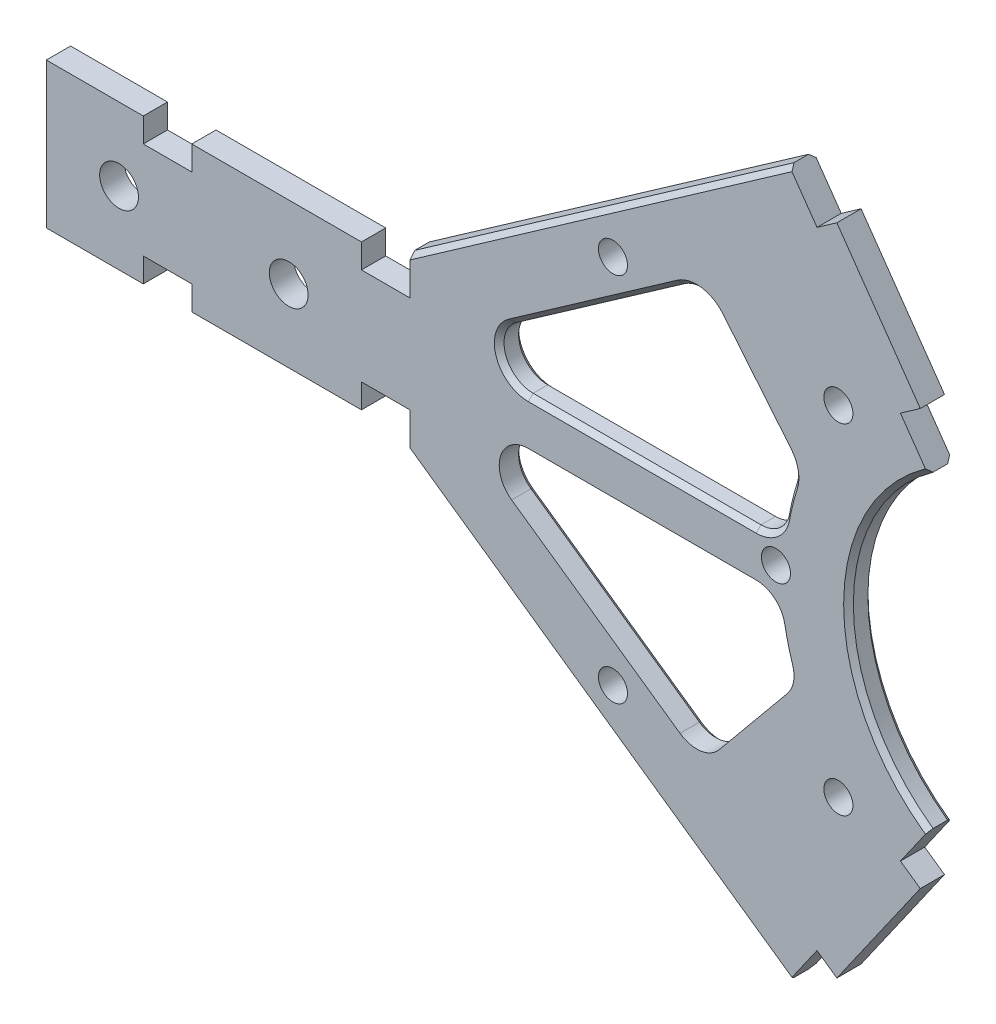
from build123d import *

# Parameters (mm, degrees)
SKETCH1_R           = 4
SKETCH1_R_2         = 3
BOSS_EXTRUDE1_DEPTH = 5
CHAMFER1_SIZE       = 1


with BuildPart() as part:
    # Sketch1 → Boss-Extrude1 (new body)
    with BuildSketch(Plane.XY):
        with BuildLine():
            Line((-184.5, 15), (-204.5, 15))
            Line((-204.5, 15), (-204.5, -15))
            Line((-204.5, -15), (-184.5, -15))
            Line((-184.5, -15), (-184.5, -10))
            Line((-184.5, -10), (-174.5, -10))
            Line((-174.5, -10), (-174.5, -15))
            Line((-174.5, -15), (-139.5, -15))
            Line((-139.5, -15), (-139.5, -10))
            Line((-139.5, -10), (-129.5, -10))
            Line((-129.5, -10), (-129.5, -18))
            Line((-129.5, -18), (-51.27097977, -72.776549672))
            Line((-51.27097977, -72.776549672), (-45.535215407, -64.585029229))
            Line((-45.535215407, -64.585029229), (-41.439455185, -67.45291141))
            Line((-41.439455185, -67.45291141), (-24.232162095, -42.878350082))
            Line((-24.232162095, -42.878350082), (-28.327922316, -40.0104679))
            Line((-28.327922316, -40.0104679), (-22.592157953, -31.818947457))
            ThreePointArc((-22.592157953, -31.818947457), (-39.041003155, 0), (-22.592157953, 31.818947457))
            Line((-22.592157953, 31.818947457), (-28.327922316, 40.0104679))
            Line((-28.327922316, 40.0104679), (-24.232162095, 42.878350082))
            Line((-24.232162095, 42.878350082), (-41.439455185, 67.45291141))
            Line((-41.439455185, 67.45291141), (-45.535215407, 64.585029229))
            Line((-45.535215407, 64.585029229), (-51.27097977, 72.776549672))
            Line((-51.27097977, 72.776549672), (-129.5, 18))
            Line((-129.5, 18), (-129.5, 10))
            Line((-129.5, 10), (-139.5, 10))
            Line((-139.5, 10), (-139.5, 15))
            Line((-139.5, 15), (-174.5, 15))
            Line((-174.5, 15), (-174.5, 10))
            Line((-174.5, 10), (-184.5, 10))
            Line((-184.5, 10), (-184.5, 15))
        make_face()
        with Locations((-189.5, 0)):
            Circle(SKETCH1_R, mode=Mode.SUBTRACT)
        with Locations((-154.5, 0)):
            Circle(SKETCH1_R, mode=Mode.SUBTRACT)
        with Locations((-87.62177039, -38.25)):
            Circle(SKETCH1_R_2, mode=Mode.SUBTRACT)
        with BuildLine():
            ThreePointArc((-108.526566115, -15.594912266), (-110.807409201, -8.875765203), (-105.085107497, -4.68))
            Line((-105.085107497, -4.68), (-58.085107497, -4.68))
            ThreePointArc((-58.085107497, -4.68), (-54.245193558, -6.069678868), (-52.184028704, -9.594979687))
            ThreePointArc((-52.184028704, -9.594979687), (-51.473369837, -12.873565341), (-50.556941566, -16.100687765))
            ThreePointArc((-50.556941566, -16.100687765), (-50.382621181, -19.057762854), (-51.644278452, -21.737856436))
            Line((-51.644278452, -21.737856436), (-65.722800473, -38.816469322))
            ThreePointArc((-65.722800473, -38.816469322), (-69.543442391, -40.945195384), (-73.794006591, -39.914912266))
            Line((-73.794006591, -39.914912266), (-108.526566115, -15.594912266))
        make_face(mode=Mode.SUBTRACT)
        with Locations((-41.12177039, -35)):
            Circle(SKETCH1_R_2, mode=Mode.SUBTRACT)
        with BuildLine():
            Line((-58.085107497, 4.68), (-105.085107497, 4.68))
            ThreePointArc((-105.085107497, 4.68), (-110.807409201, 8.875765203), (-108.526566115, 15.594912266))
            Line((-108.526566115, 15.594912266), (-73.794006591, 39.914912266))
            ThreePointArc((-73.794006591, 39.914912266), (-69.543442391, 40.945195384), (-65.722800473, 38.816469322))
            Line((-65.722800473, 38.816469322), (-51.644278452, 21.737856436))
            ThreePointArc((-51.644278452, 21.737856436), (-50.382621181, 19.057762854), (-50.556941566, 16.100687765))
            ThreePointArc((-50.556941566, 16.100687765), (-51.473369837, 12.873565341), (-52.184028704, 9.594979687))
            ThreePointArc((-52.184028704, 9.594979687), (-54.245193558, 6.069678868), (-58.085107497, 4.68))
        make_face(mode=Mode.SUBTRACT)
        with Locations((-54, 0)):
            Circle(SKETCH1_R_2, mode=Mode.SUBTRACT)
        with Locations((-41.12177039, 35)):
            Circle(SKETCH1_R_2, mode=Mode.SUBTRACT)
        with Locations((-87.62177039, 38.25)):
            Circle(SKETCH1_R_2, mode=Mode.SUBTRACT)
    extrude(amount=BOSS_EXTRUDE1_DEPTH)

    # Chamfer1
    chamfer1_edges = [part.edges().sort_by_distance(p)[0] for p in [
        (-90.385489885, -45.388274836, 5),
        (-90.385489885, -45.388274836, 0),
        (-39.041003155, 0, 5),
        (-39.041003155, 0, 0),
        (-90.385489885, 45.388274836, 5),
        (-90.385489885, 45.388274836, 0),
        (-58.683539462, -30.277162879, 0),
        (-50.382621181, -19.057762854, 0),
        (-69.543442391, -40.945195384, 0),
        (-51.473369837, -12.873565341, 0),
        (-91.160286353, -27.754912266, 0),
        (-54.245193558, -6.069678868, 0),
        (-110.807409201, -8.875765203, 0),
        (-81.585107497, -4.68, 0),
        (-50.382621181, 19.057762854, 5),
        (-58.683539462, 30.277162879, 5),
        (-51.473369837, 12.873565341, 5),
        (-69.543442391, 40.945195384, 5),
        (-54.245193558, 6.069678868, 5),
        (-91.160286353, 27.754912266, 5),
        (-81.585107497, 4.68, 5),
        (-110.807409201, 8.875765203, 5),
        (-51.473369837, 12.873565341, 0),
        (-50.382621181, 19.057762854, 0),
        (-54.245193558, 6.069678868, 0),
        (-58.683539462, 30.277162879, 0),
        (-81.585107497, 4.68, 0),
        (-69.543442391, 40.945195384, 0),
        (-110.807409201, 8.875765203, 0),
        (-91.160286353, 27.754912266, 0),
    ]]
    chamfer(chamfer1_edges, length=CHAMFER1_SIZE)


solid = part.part
